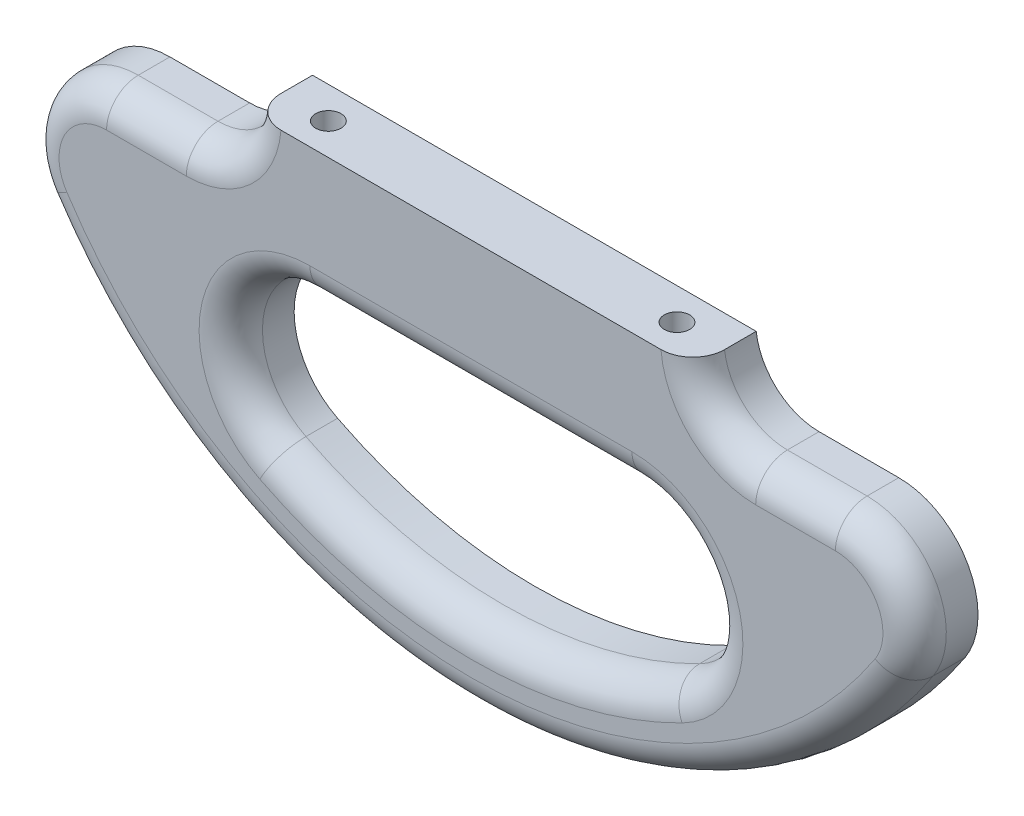
from build123d import *

# Parameters (mm, degrees)
SKETCH1_R                = 2.15
BOSS_EXTRUDE1_DEPTH      = 8
BOSS_EXTRUDE2_START      = -4
BOSS_EXTRUDE2_DEPTH      = 4
SKETCH3_W                = 56
SKETCH3_H                = 8
BOSS_EXTRUDE6_DEPTH      = 7
BOSS_EXTRUDE4_START      = -8
BOSS_EXTRUDE4_DEPTH      = 8
CUT_EXTRUDE1_DEPTH       = 67.44206881
FILLET4_R                = 8
FILLET3_R                = 4
M3_CLEARANCE_HOLE1_D     = 3.2
M3_CLEARANCE_HOLE1_DEPTH = 8
M3_CLEARANCE_HOLE1_TIP   = 0.96137699


with BuildPart() as part:
    # Sketch1 → Boss-Extrude1 (new body)
    with BuildSketch(Plane.XY):
        with BuildLine():
            Line((-46, 10), (46, 10))
            ThreePointArc((46, 10), (56, 0), (46, -10))
            Line((46, -10), (-46, -10))
            ThreePointArc((-46, -10), (-56, 0), (-46, 10))
        make_face()
        with Locations((-46, 0)):
            Circle(SKETCH1_R, mode=Mode.SUBTRACT)
        with Locations((46, 0)):
            Circle(SKETCH1_R, mode=Mode.SUBTRACT)
    extrude(amount=BOSS_EXTRUDE1_DEPTH)

    # Sketch2 → Boss-Extrude2 (add)
    with BuildSketch(Plane.XY.offset(8).offset(BOSS_EXTRUDE2_START)):
        with BuildLine():
            Line((-46, -10), (46, -10))
            ThreePointArc((46, -10), (56, 0), (46, 10))
            Line((46, 10), (-46, 10))
            ThreePointArc((-46, 10), (-56, 0), (-46, -10))
        make_face()
    extrude(amount=BOSS_EXTRUDE2_DEPTH)

    # Sketch3 → Boss-Extrude6 (add)
    with BuildSketch(Plane(origin=(0, 10, 0), x_dir=(1, 0, 0), z_dir=(0, 1, 0))):
        with Locations((0, -4)):
            Rectangle(SKETCH3_W, SKETCH3_H)
    extrude(amount=BOSS_EXTRUDE6_DEPTH)

    # Sketch4 → Boss-Extrude4 (add)
    with BuildSketch(Plane.XY.offset(8).offset(BOSS_EXTRUDE4_START)):
        with BuildLine():
            Line((-46, -10), (46, -10))
            ThreePointArc((46, -10), (50.753025174, -8.798224349), (54.363636364, -5.481750339))
            ThreePointArc((54.363636364, -5.481750339), (0, -34.850373137), (-54.363636364, -5.481750339))
            ThreePointArc((-54.363636364, -5.481750339), (-50.753025174, -8.798224349), (-46, -10))
        make_face()
    extrude(amount=BOSS_EXTRUDE4_DEPTH)

    # Sketch5 → Cut-Extrude1 (cut, through all)
    with BuildSketch(Plane(origin=(0, 0, 0), x_dir=(-1, 0, 0), z_dir=(0, 0, -1))):
        with BuildLine():
            Line((-20.322585041, 0), (20.322585041, 0))
            ThreePointArc((20.322585041, 0), (30.049388036, -7.678512657), (24.83871505, -18.922139303))
            ThreePointArc((24.83871505, -18.922139303), (0, -24.850373137), (-24.83871505, -18.922139303))
            ThreePointArc((-24.83871505, -18.922139303), (-30.049388036, -7.678512657), (-20.322585041, 0))
        make_face()
    extrude(amount=-CUT_EXTRUDE1_DEPTH, mode=Mode.SUBTRACT)

    # Fillet4
    # the kernel refuses this fillet: 8 mm, written as the material it adds along each edge
    with BuildSketch(Plane(origin=(28, 10, 8), x_dir=(0, 1, 0), z_dir=(0, 0, -1))) as fillet4_piece_1:
        with BuildLine():
            CenterArc((8, 7.937253933), FILLET4_R, 180, 82.819244219)
            Line((0, 7.937253933), (-0.16, 7.937253933))
            Line((-0.16, 7.937253933), (-0.16, 0))
            Line((-0.16, 0), (0, -0.16))
            ThreePointArc((0, -0.16), (3.5, -0.16), (6.98, -0.158745079))
            Line((6.98, -0.158745079), (7, 0))
        make_face()
    extrude(amount=8)
    with BuildSketch(Plane(origin=(-28, 10, 0), x_dir=(-1, 0, 0), z_dir=(0, 0, 1))) as fillet4_piece_2:
        with BuildLine():
            CenterArc((7.937253933, -8), FILLET4_R, 90, 82.819244219)
            Line((0, -7), (-0.158745079, -6.98))
            ThreePointArc((-0.158745079, -6.98), (-0.16, -3.5), (-0.16, 0))
            Line((-0.16, 0), (0, 0.16))
            Line((0, 0.16), (7.937253933, 0.16))
            Line((7.937253933, 0.16), (7.937253933, 0))
        make_face()
    extrude(amount=8)

    # Fillet3
    fillet3_edges = [part.edges().sort_by_distance(p)[0] for p in [
        (40.968626967, 10, 8),
        (-54.798224349, 4.753025174, 8),
        (54.798224349, 4.753025174, 8),
        (0, -34.850373137, 8),
        (-30.049388036, -7.678512657, 8),
        (0, -24.850373137, 8),
        (30.049388036, -7.678512657, 8),
        (0, 0, 8),
        (-40.968626967, 10, 8),
        (30.645751311, 12, 8),
        (-30.645751311, 12, 8),
    ]]
    fillet(fillet3_edges, radius=FILLET3_R)

    # M3 Clearance Hole1
    with Locations(Plane(origin=(0, 17, 0), x_dir=(1, 0, 0), z_dir=(0, 1, 0))):
        with Locations((-22, -4), (22, -4)):
            Hole(M3_CLEARANCE_HOLE1_D / 2, depth=M3_CLEARANCE_HOLE1_DEPTH)
            with Locations((0, 0, -(M3_CLEARANCE_HOLE1_DEPTH + M3_CLEARANCE_HOLE1_TIP / 2))):  # 118° drill point
                Cone(0, M3_CLEARANCE_HOLE1_D / 2, M3_CLEARANCE_HOLE1_TIP, mode=Mode.SUBTRACT)


solid = part.part
